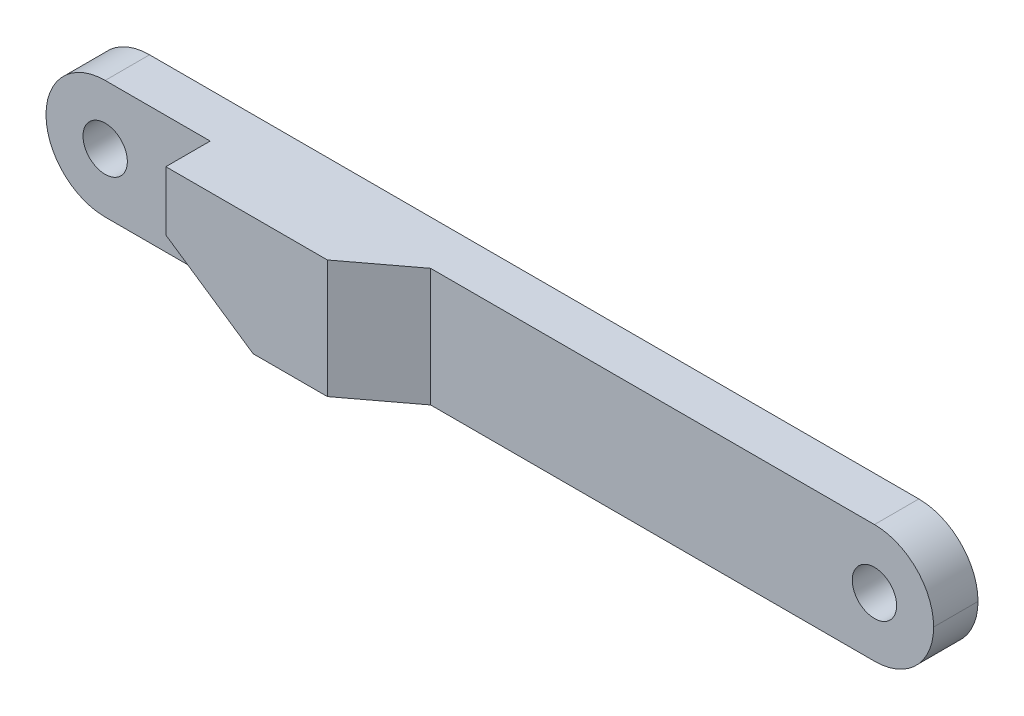
from build123d import *

# Parameters (mm, degrees)
SZKIC1_W                    = 60
SZKIC1_H                    = 8
DODANIE_WYCI_GNI_CIE1_DEPTH = 3
ZAOKR_GLENIE1_R             = 4
SZKIC2_R                    = 1.5
WYTNIJ_WYCI_GNI_CIE1_DEPTH  = 3
DODANIE_WYCI_GNI_CIE2_DEPTH = 3
SFAZOWANIE1_SIZE            = 4
SFAZOWANIE1_SIZE_2          = 3.0142162
WYTNIJ_WYCI_GNI_CIE2_DEPTH  = 3


# Some blends are built 0.0001 mm under size
with BuildPart() as part:
    # Szkic1 → Dodanie-wyciągnięcie1 (new body)
    with BuildSketch(Plane.XY):
        with Locations((30, 4)):
            Rectangle(SZKIC1_W, SZKIC1_H)
    extrude(amount=DODANIE_WYCI_GNI_CIE1_DEPTH)

    # Zaokrąglenie1
    zaokr_glenie1_edges = [part.edges().sort_by_distance(p)[0] for p in [
        (60, 0, 1.5),
        (60, 8, 1.5),
        (0, 8, 1.5),
        (0, 0, 1.5),
    ]]
    fillet(zaokr_glenie1_edges, radius=ZAOKR_GLENIE1_R - 0.0001)  # a hair under: the kernel refuses the full size

    # Szkic2 → Wytnij-wyciągnięcie1 (cut)
    with BuildSketch(Plane.XY.offset(3)):
        with Locations((4, 4)):
            Circle(SZKIC2_R)
        with Locations((56, 4)):
            Circle(SZKIC2_R)
    extrude(amount=-WYTNIJ_WYCI_GNI_CIE1_DEPTH, mode=Mode.SUBTRACT)

    # Szkic3 → Dodanie-wyciągnięcie2 (add)
    with BuildSketch(Plane.XY.offset(3)):
        Polygon((5.2, 8), (17, 0), (22, 0), (22, 8), align=None)
    extrude(amount=DODANIE_WYCI_GNI_CIE2_DEPTH)

    # Sfazowanie1
    # the kernel refuses this chamfer: 4, 3.0142162 mm, written as the material it adds along each edge
    with BuildSketch(Plane(origin=(22, 0, 3), x_dir=(0.9997280272590686, 0, -0.023321052992758322), z_dir=(0, 1, 0))) as sfazowanie1_piece_1_section:
        Polygon((SFAZOWANIE1_SIZE * 0.999728027259, -SFAZOWANIE1_SIZE * 0.0233210529928), (-SFAZOWANIE1_SIZE_2 * 0.0233210529959, -SFAZOWANIE1_SIZE_2 * 0.999728027395), (0, 0), align=None)
    sfazowanie1_piece_1 = extrude(amount=8, mode=Mode.PRIVATE)
    sfazowanie1_piece_1 = split(sfazowanie1_piece_1, bisect_by=Plane(origin=(23.333090008, 4, 6), z_dir=(0, 0, -1)), keep=Keep.TOP, mode=Mode.PRIVATE)
    add(sfazowanie1_piece_1)

    # Szkic4 → Wytnij-wyciągnięcie2 (cut)
    with BuildSketch(Plane.XY.offset(6)):
        Polygon((5.2, 8), (11.1, 4), (11.1, 8), align=None)
    extrude(amount=-WYTNIJ_WYCI_GNI_CIE2_DEPTH, mode=Mode.SUBTRACT)


solid = part.part
